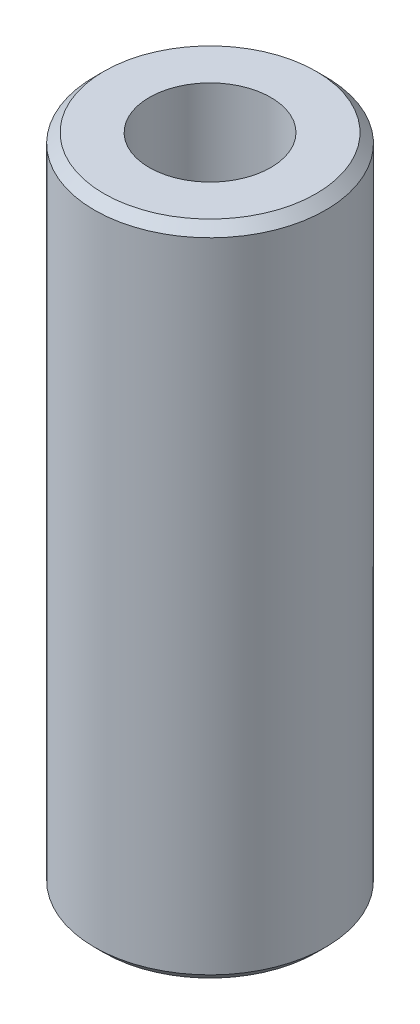
from build123d import *

# Parameters (mm, degrees)
SKETCH1_R           = 47.5
BOSS_EXTRUDE1_DEPTH = 270.190778243
SKETCH2_R           = 24.984539587
CUT_EXTRUDE1_DEPTH  = 279.416157304
CHAMFER1_SIZE       = 3.904020939


with BuildPart() as part:
    # Sketch1 → Boss-Extrude1 (new body)
    with BuildSketch(Plane(origin=(0, 0, 0), x_dir=(1, 0, 0), z_dir=(0, 1, 0))):
        Circle(SKETCH1_R)
    extrude(amount=BOSS_EXTRUDE1_DEPTH)

    # Sketch2 → Cut-Extrude1 (cut, through all)
    with BuildSketch(Plane(origin=(0, 0, 0), x_dir=(1, 0, 0), z_dir=(0, 1, 0))):
        Circle(SKETCH2_R)
    extrude(amount=CUT_EXTRUDE1_DEPTH, mode=Mode.SUBTRACT)

    # Chamfer1
    chamfer1_edges = [part.edges().sort_by_distance(p)[0] for p in [
        (-47.5, 270.190778243, 0),
        (-47.5, 0, 0),
    ]]
    chamfer(chamfer1_edges, length=CHAMFER1_SIZE)


solid = part.part
